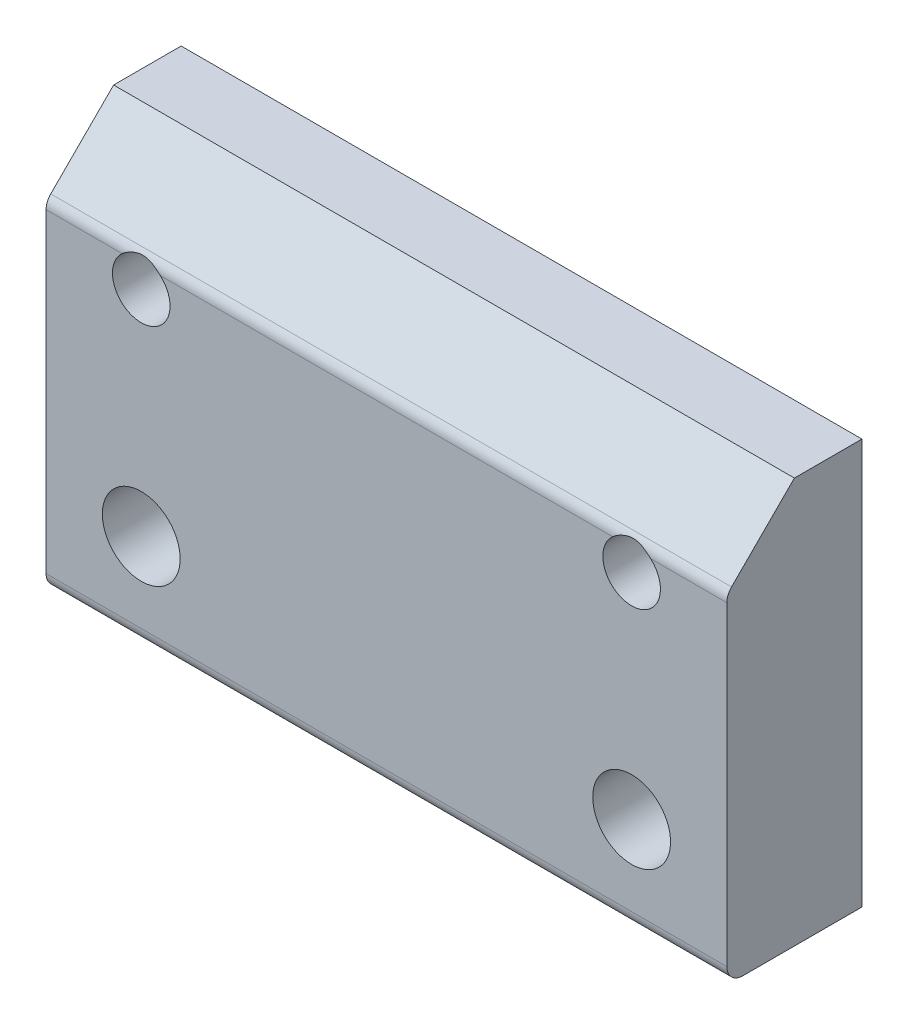
from build123d import *

# Parameters (mm, degrees)
BOSS_EXTRUDE1_DEPTH       = 16
F_6_32_TAPPED_HOLE1_D     = 2.7051
F_6_32_TAPPED_HOLE1_DEPTH = 9.398
F_6_32_TAPPED_HOLE1_TIP   = 0.81269403
FILLET1_R                 = 0.75
F_6_CLEARANCE_HOLE2_D     = 3.6576


with BuildPart() as part:
    # Sketch1 → Boss-Extrude1 (new, symmetric)
    with BuildSketch(Plane(origin=(0, 0, 0), x_dir=(0, 0, -1), z_dir=(1, 0, 0))):
        Polygon((0, 6.35), (3.175, 9.525), (6.35, 9.525), (6.35, -9.525), (0, -9.525), align=None)
    extrude(amount=BOSS_EXTRUDE1_DEPTH, both=True)

    # #6-32 Tapped Hole1
    with Locations(Plane(origin=(0, 0, -6.35), x_dir=(-1, 0, 0), z_dir=(0, 0, -1))):
        with Locations((11.525, 5.025), (-11.525, 5.025)):
            Hole(F_6_32_TAPPED_HOLE1_D / 2, depth=F_6_32_TAPPED_HOLE1_DEPTH)
            with Locations((0, 0, -(F_6_32_TAPPED_HOLE1_DEPTH + F_6_32_TAPPED_HOLE1_TIP / 2))):  # 118° drill point
                Cone(0, F_6_32_TAPPED_HOLE1_D / 2, F_6_32_TAPPED_HOLE1_TIP, mode=Mode.SUBTRACT)

    # Fillet1
    # the kernel refuses this fillet: 0.75 mm, written as the material it takes off along each edge
    with BuildSketch(Plane(origin=(-16.776650429, 6.35, 0), x_dir=(0, 0.707106781186552, -0.7071067811865431), z_dir=(1, 0, 0)), Plane(origin=(11.019949465, 6.35, 0), x_dir=(0, 0.707106781186552, -0.7071067811865431), z_dir=(1, 0, 0))) as fillet1_piece_1:
        with BuildLine():
            CenterArc((FILLET1_R * 0.414213562373, -FILLET1_R), FILLET1_R, 90, 45)
            Line((-FILLET1_R * 0.292893218813, -FILLET1_R * 0.292893218813), (0, 0))
            Line((0, 0), (FILLET1_R * 0.414213562373, 0))
        make_face()
    extrude(amount=5.756700965, mode=Mode.SUBTRACT)
    with BuildSketch(Plane(origin=(-12.030050535, 6.35, 0), x_dir=(0, 0.707106781186552, -0.7071067811865431), z_dir=(1, 0, 0))) as fillet1_piece_2:
        with BuildLine():
            CenterArc((FILLET1_R * 0.414213562373, -FILLET1_R), FILLET1_R, 90, 45)
            Line((-FILLET1_R * 0.292893218813, -FILLET1_R * 0.292893218813), (0, 0))
            Line((0, 0), (FILLET1_R * 0.414213562373, 0))
        make_face()
    extrude(amount=24.060101071, mode=Mode.SUBTRACT)
    with BuildSketch(Plane(origin=(-17.875, -9.525, 0), x_dir=(0, 1, 0), z_dir=(1, 0, 0))) as fillet1_piece_3:
        with BuildLine():
            CenterArc((FILLET1_R, -FILLET1_R), FILLET1_R, 90, 90)
            Line((0, -FILLET1_R), (0, 0))
            Line((0, 0), (FILLET1_R, 0))
        make_face()
    extrude(amount=35.75, mode=Mode.SUBTRACT)

    # #6 Clearance Hole2 (through all)
    with Locations(Plane(origin=(0, 0, -6.35), x_dir=(-1, 0, 0), z_dir=(0, 0, -1))):
        with Locations((-11.525, -5.025), (11.525, -5.025)):
            Hole(F_6_CLEARANCE_HOLE2_D / 2)


solid = part.part
